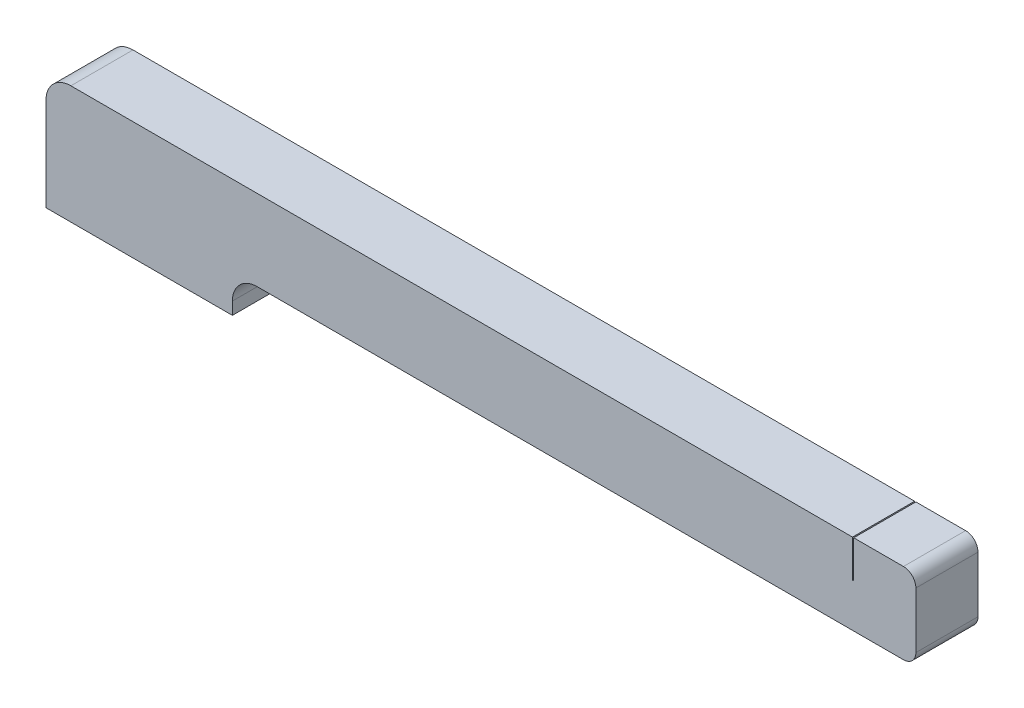
from build123d import *

# Parameters (mm, degrees)
BOSS_EXTRUDE1_DEPTH = 5
SKETCH3_W           = 0.1
SKETCH3_H           = 5
CUT_EXTRUDE1_DEPTH  = 3


with BuildPart() as part:
    # Sketch1 → Boss-Extrude1 (new body)
    with BuildSketch(Plane.XY):
        with BuildLine():
            Line((0, 0), (0, 7.5))
            ThreePointArc((0, 7.5), (0.585786438, 8.914213562), (2, 9.5))
            Line((2, 9.5), (69, 9.5))
            ThreePointArc((69, 9.5), (69.707106781, 9.207106781), (70, 8.5))
            Line((70, 8.5), (70, 4))
            ThreePointArc((70, 4), (69.707106781, 3.292893219), (69, 3))
            Line((69, 3), (17, 3))
            ThreePointArc((17, 3), (15.585786438, 2.414213562), (15, 1))
            Line((15, 1), (15, 0))
            Line((15, 0), (0, 0))
        make_face()
    extrude(amount=BOSS_EXTRUDE1_DEPTH)

    # Sketch3 → Cut-Extrude1 (cut)
    with BuildSketch(Plane(origin=(0, 9.5, 0), x_dir=(1, 0, 0), z_dir=(0, 1, 0))):
        with Locations((64.95, -2.5)):
            Rectangle(SKETCH3_W, SKETCH3_H)
    extrude(amount=-CUT_EXTRUDE1_DEPTH, mode=Mode.SUBTRACT)


solid = part.part
